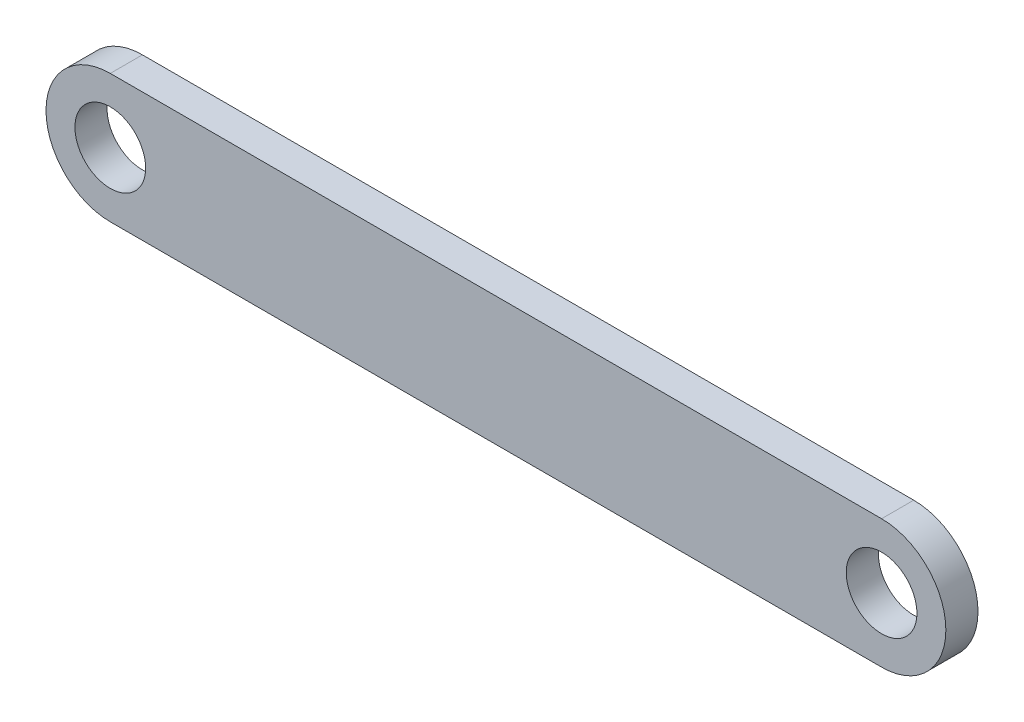
from build123d import *

# Parameters (mm, degrees)
SKETCH1_R           = 5.5
BOSS_EXTRUDE1_DEPTH = 5


with BuildPart() as part:
    # Sketch1 → Boss-Extrude1 (new body)
    with BuildSketch(Plane.XY):
        with BuildLine():
            Line((-60, 10), (60, 10))
            ThreePointArc((60, 10), (70, 0), (60, -10))
            Line((60, -10), (-60, -10))
            ThreePointArc((-60, -10), (-70, 0), (-60, 10))
        make_face()
        with Locations((-60, 0)):
            Circle(SKETCH1_R, mode=Mode.SUBTRACT)
        with Locations((60, 0)):
            Circle(SKETCH1_R, mode=Mode.SUBTRACT)
    extrude(amount=BOSS_EXTRUDE1_DEPTH)


solid = part.part
